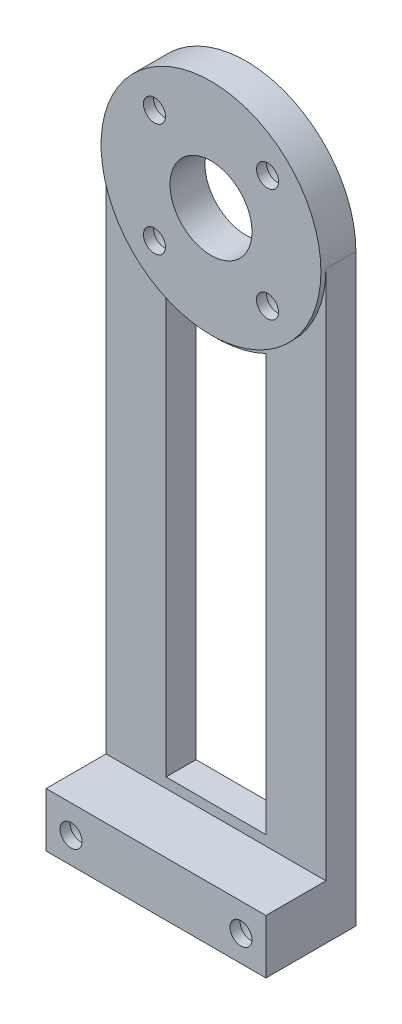
from build123d import *
from build123d.topology import SkipClean

# Parameters (mm, degrees)
BOSS_EXTRUDE1_DEPTH           = 3
BOSS_EXTRUDE2_START           = -0.5
SKETCH1_3_R                   = 11
BOSS_EXTRUDE2_DEPTH           = 0.5
SKETCH2_R                     = 4.1
SKETCH2_R_2                   = 1.1
CUT_EXTRUDE1_DEPTH            = 3.5
SKETCH2_3_R                   = 2
CUT_EXTRUDE2_DEPTH            = 2.5
CIRPATTERN2_COUNT             = 4
SKETCH1_6_W                   = 11
SKETCH1_6_H                   = 5.42
BOSS_EXTRUDE3_DEPTH           = 6
SKETCH3_R                     = 1.1
CUT_EXTRUDE3_DEPTH            = 9
SKETCH3_3_R                   = 2
SKETCH3_3_R_2                 = 1.1
CUT_EXTRUDE4_DEPTH            = 8
BODY_MOVE_COPY1_START         = -3
BODY_MOVE_COPY1_OUTLINE_R     = 2
BODY_MOVE_COPY1_OUTLINE_R_2   = 4.1
BODY_MOVE_COPY1_DEPTH         = 3
BODY_MOVE_COPY1_START_2       = 3
BODY_MOVE_COPY1_2_OUTLINE_W   = 22
BODY_MOVE_COPY1_2_OUTLINE_H   = 5.42
BODY_MOVE_COPY1_2_OUTLINE_R   = 2
BODY_MOVE_COPY1_2_DEPTH       = 3
BODY_MOVE_COPY1_START_3       = 5
BODY_MOVE_COPY1_3_OUTLINE_R   = 2
BODY_MOVE_COPY1_3_OUTLINE_R_2 = 1.1
BODY_MOVE_COPY1_3_DEPTH       = 1
BODY_MOVE_COPY1_START_4       = 0.5
BODY_MOVE_COPY1_4_OUTLINE_R   = 2
BODY_MOVE_COPY1_4_OUTLINE_R_2 = 4.1
BODY_MOVE_COPY1_4_DEPTH       = 2.5
BODY_MOVE_COPY1_START_5       = -6
BODY_MOVE_COPY1_5_OUTLINE_W   = 22
BODY_MOVE_COPY1_5_OUTLINE_H   = 5.42
BODY_MOVE_COPY1_5_OUTLINE_R   = 1.1
BODY_MOVE_COPY1_5_DEPTH       = 3
BODY_MOVE_COPY1_6_DEPTH       = 0.5


# Read off the part's stored shape, not the designer's step: Body-Move/Copy1
with BuildPart() as part:
    # Sketch1 → Boss-Extrude1 (new body)
    with BuildSketch(Plane.XY):
        with BuildLine():
            Line((-11, 29.235), (-11, -29.235))
            Line((-11, -29.235), (11, -29.235))
            Line((11, -29.235), (11, 29.235))
            ThreePointArc((11, 29.235), (0, 40.235), (-11, 29.235))
        make_face()
        with BuildLine():
            Line((5, -22.815), (-5, -22.815))
            Line((-5, -22.815), (-5, 18.878842411))
            ThreePointArc((-5, 18.878842411), (0, 17.735), (5, 18.878842411))
            Line((5, 18.878842411), (5, -22.815))
        make_face(mode=Mode.SUBTRACT)
    extrude(amount=BOSS_EXTRUDE1_DEPTH)

    # Sketch1<3> → Boss-Extrude2 (add)
    with BuildSketch(Plane.XY.offset(BOSS_EXTRUDE2_START)):
        with Locations((0, 29.235)):
            Circle(SKETCH1_3_R)
    extrude(amount=BOSS_EXTRUDE2_DEPTH)

    # Sketch2 → Cut-Extrude1 (cut)
    with BuildSketch(Plane.XY.offset(3)):
        with Locations((0, 29.235)):
            Circle(SKETCH2_R)
        with Locations((5.656854249, 34.891854249)):
            Circle(SKETCH2_R_2)
    cut_extrude1 = extrude(amount=-CUT_EXTRUDE1_DEPTH, mode=Mode.SUBTRACT)

    # Sketch2<3> → Cut-Extrude2 (cut)
    with BuildSketch(Plane.XY.offset(3)):
        with Locations((5.656854249, 34.891854249)):
            Circle(SKETCH2_3_R)
    cut_extrude2 = extrude(amount=-CUT_EXTRUDE2_DEPTH, mode=Mode.SUBTRACT)

    # CirPattern2: Cut-Extrude1, Cut-Extrude2 ×4 about axis
    cirpattern2_axis = Axis((0, 29.235, 0), (0, 0, 1))
    add([cut_extrude1.rotate(cirpattern2_axis, i * 360 / CIRPATTERN2_COUNT) for i in range(1, CIRPATTERN2_COUNT)], mode=Mode.SUBTRACT)
    add([cut_extrude2.rotate(cirpattern2_axis, i * 360 / CIRPATTERN2_COUNT) for i in range(1, CIRPATTERN2_COUNT)], mode=Mode.SUBTRACT)

    # Sketch1<6> → Boss-Extrude3 (add)
    with BuildSketch(Plane.XY):
        with Locations((-5.5, -26.525)):
            Rectangle(SKETCH1_6_W, SKETCH1_6_H)
        with Locations((5.5, -26.525)):
            Rectangle(SKETCH1_6_W, SKETCH1_6_H)
    extrude(amount=-BOSS_EXTRUDE3_DEPTH)

    # Sketch3 → Cut-Extrude3 (cut)
    with BuildSketch(Plane.XY.offset(3)):
        with Locations((-8.5, -26.62018786)):
            Circle(SKETCH3_R)
        with Locations((8.5, -26.62018786)):
            Circle(SKETCH3_R)
    extrude(amount=-CUT_EXTRUDE3_DEPTH, mode=Mode.SUBTRACT)

    # Sketch3<3> → Cut-Extrude4 (cut)
    # profile 1 of 2: a face of its own
    with BuildSketch(Plane.XY.offset(3)):
        with Locations((-8.5, -26.62018786)):
            Circle(SKETCH3_3_R)
        with Locations((-8.5, -26.62018786)):
            Circle(SKETCH3_3_R_2, mode=Mode.SUBTRACT)
    # profile 2 of 2: a face of its own
    with BuildSketch(Plane.XY.offset(3)):
        with Locations((8.5, -26.62018786)):
            Circle(SKETCH3_3_R)
        with Locations((8.5, -26.62018786)):
            Circle(SKETCH3_3_R_2, mode=Mode.SUBTRACT)
    extrude(amount=-CUT_EXTRUDE4_DEPTH, mode=Mode.SUBTRACT)

    # Body-Move/Copy1 outline → Body-Move/Copy1 (add)
    with BuildSketch(Plane.XY.offset(BODY_MOVE_COPY1_START)):
        with BuildLine():
            Line((-11, -23.815), (11, -23.815))
            Line((11, -23.815), (11, 29.235))
            ThreePointArc((11, 29.235), (0, 40.235), (-11, 29.235))
            Line((-11, 29.235), (-11, -23.815))
        make_face()
        with BuildLine():
            Line((5, 18.878842411), (5, -22.815))
            Line((5, -22.815), (-5, -22.815))
            Line((-5, -22.815), (-5, 18.878842411))
            ThreePointArc((-5, 18.878842411), (0, 17.735), (5, 18.878842411))
        make_face(mode=Mode.SUBTRACT)
        with Locations((5.656854249, 34.891854249)):
            Circle(BODY_MOVE_COPY1_OUTLINE_R, mode=Mode.SUBTRACT)
        with Locations((-5.656854249, 23.578145751)):
            Circle(BODY_MOVE_COPY1_OUTLINE_R, mode=Mode.SUBTRACT)
        with Locations((-5.656854249, 34.891854249)):
            Circle(BODY_MOVE_COPY1_OUTLINE_R, mode=Mode.SUBTRACT)
        with Locations((0, 29.235)):
            Circle(BODY_MOVE_COPY1_OUTLINE_R_2, mode=Mode.SUBTRACT)
        with Locations((5.656854249, 23.578145751)):
            Circle(BODY_MOVE_COPY1_OUTLINE_R, mode=Mode.SUBTRACT)
    extrude(amount=BODY_MOVE_COPY1_DEPTH)

    # Body-Move_Copy1 2 outline → Body-Move_Copy1 2 (add)
    with BuildSketch(Plane.XY.offset(BODY_MOVE_COPY1_START_2)):
        with Locations((0, -26.525)):
            Rectangle(BODY_MOVE_COPY1_2_OUTLINE_W, BODY_MOVE_COPY1_2_OUTLINE_H)
        with Locations((-8.5, -26.62018786)):
            Circle(BODY_MOVE_COPY1_2_OUTLINE_R, mode=Mode.SUBTRACT)
        with Locations((8.5, -26.62018786)):
            Circle(BODY_MOVE_COPY1_2_OUTLINE_R, mode=Mode.SUBTRACT)
    extrude(amount=BODY_MOVE_COPY1_2_DEPTH)

    # Body-Move_Copy1 3 outline → Body-Move_Copy1 3 (add)
    # profile 1 of 2: a face of its own
    with BuildSketch(Plane.XY.offset(BODY_MOVE_COPY1_START_3)):
        with Locations((-8.5, -26.62018786)):
            Circle(BODY_MOVE_COPY1_3_OUTLINE_R)
        with Locations((-8.5, -26.62018786)):
            Circle(BODY_MOVE_COPY1_3_OUTLINE_R_2, mode=Mode.SUBTRACT)
    # profile 2 of 2: a face of its own
    with BuildSketch(Plane.XY.offset(BODY_MOVE_COPY1_START_3)):
        with Locations((8.5, -26.62018786)):
            Circle(BODY_MOVE_COPY1_3_OUTLINE_R)
        with Locations((8.5, -26.62018786)):
            Circle(BODY_MOVE_COPY1_3_OUTLINE_R_2, mode=Mode.SUBTRACT)
    extrude(amount=BODY_MOVE_COPY1_3_DEPTH)

    # Body-Move_Copy1 4 outline → Body-Move_Copy1 4 (cut)
    with BuildSketch(Plane.XY.offset(BODY_MOVE_COPY1_START_4)):
        with BuildLine():
            Line((-11, -23.815), (11, -23.815))
            Line((11, -23.815), (11, 29.235))
            ThreePointArc((11, 29.235), (0, 40.235), (-11, 29.235))
            Line((-11, 29.235), (-11, -23.815))
        make_face()
        with BuildLine():
            Line((5, 18.878842411), (5, -22.815))
            Line((5, -22.815), (-5, -22.815))
            Line((-5, -22.815), (-5, 18.878842411))
            ThreePointArc((-5, 18.878842411), (0, 17.735), (5, 18.878842411))
        make_face(mode=Mode.SUBTRACT)
        with Locations((5.656854249, 34.891854249)):
            Circle(BODY_MOVE_COPY1_4_OUTLINE_R, mode=Mode.SUBTRACT)
        with Locations((-5.656854249, 23.578145751)):
            Circle(BODY_MOVE_COPY1_4_OUTLINE_R, mode=Mode.SUBTRACT)
        with Locations((-5.656854249, 34.891854249)):
            Circle(BODY_MOVE_COPY1_4_OUTLINE_R, mode=Mode.SUBTRACT)
        with Locations((0, 29.235)):
            Circle(BODY_MOVE_COPY1_4_OUTLINE_R_2, mode=Mode.SUBTRACT)
        with Locations((5.656854249, 23.578145751)):
            Circle(BODY_MOVE_COPY1_4_OUTLINE_R, mode=Mode.SUBTRACT)
    extrude(amount=BODY_MOVE_COPY1_4_DEPTH, mode=Mode.SUBTRACT)

    # Body-Move_Copy1 5 outline → Body-Move_Copy1 5 (cut)
    with BuildSketch(Plane.XY.offset(BODY_MOVE_COPY1_START_5)):
        with Locations((0, -26.525)):
            Rectangle(BODY_MOVE_COPY1_5_OUTLINE_W, BODY_MOVE_COPY1_5_OUTLINE_H)
        with Locations((-8.5, -26.62018786)):
            Circle(BODY_MOVE_COPY1_5_OUTLINE_R, mode=Mode.SUBTRACT)
        with Locations((8.5, -26.62018786)):
            Circle(BODY_MOVE_COPY1_5_OUTLINE_R, mode=Mode.SUBTRACT)
    extrude(amount=BODY_MOVE_COPY1_5_DEPTH, mode=Mode.SUBTRACT)

    # Body-Move_Copy1 6 outline → Body-Move_Copy1 6 (cut)
    with SkipClean():  # the faces are left unmerged after this step: merging them gives an invalid solid
        with BuildSketch(Plane.XY):
            with BuildLine():
                Line((-11, -23.815), (11, -23.815))
                Line((11, -23.815), (11, 29.235))
                ThreePointArc((11, 29.235), (0, 18.235), (-11, 29.235))
                Line((-11, 29.235), (-11, -23.815))
            make_face()
            with BuildLine():
                Line((5, 18.878842411), (5, -22.815))
                Line((5, -22.815), (-5, -22.815))
                Line((-5, -22.815), (-5, 18.878842411))
                ThreePointArc((-5, 18.878842411), (0, 17.735), (5, 18.878842411))
            make_face(mode=Mode.SUBTRACT)
        extrude(amount=BODY_MOVE_COPY1_6_DEPTH, mode=Mode.SUBTRACT)


solid = part.part
